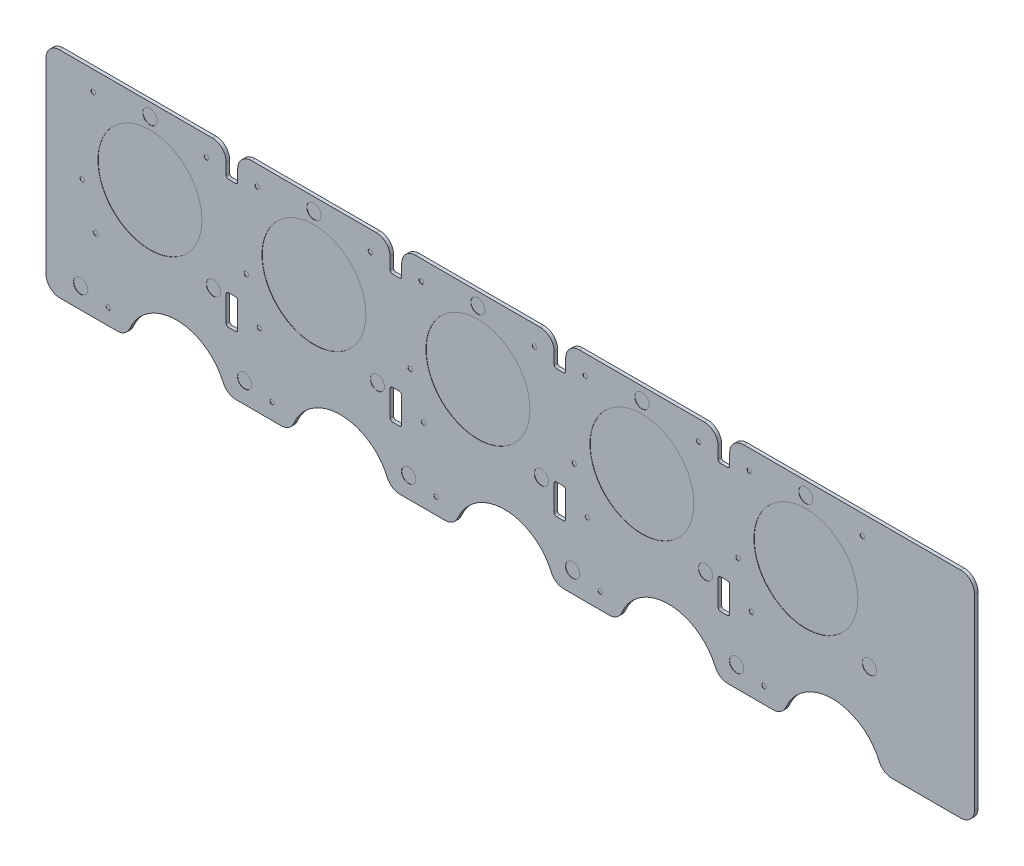
from build123d import *

# Parameters (mm, degrees)
ESQUISSE1_W                                = 402
ESQUISSE1_H                                = 93
PCB_RECTANGULAIRE_DEPTH                    = 1.5
ESQUISSE1_3_R                              = 22.5
POSITION_TROU_DEPTH                        = 0.1
PASSAGE_APPUI_FLANC_ET_PASSAGE_JETON_DEPTH = 224.220182779
R_P_TITION_LIN_AIRE1_COUNT                 = 4
R_P_TITION_LIN_AIRE1_PITCH                 = 71
ESQUISSE2_R                                = 1
ESQUISSE2_R_2                              = 3.1
POSITION_CAPTEUR_LED_DEPTH                 = 0.1
ESQUISSE4_R                                = 22
ECHAPPEMENT_DEPTH                          = 224.220182779
R_P_TITION_LIN_AIRE3_COUNT                 = 5
R_P_TITION_LIN_AIRE3_PITCH                 = 71
CONG_1_R                                   = 6


with BuildPart() as part:
    # Esquisse1 → PCB_rectangulaire (new body)
    with BuildSketch(Plane.XY):
        with Locations((14, -13.5)):
            Rectangle(ESQUISSE1_W, ESQUISSE1_H)
    extrude(amount=-PCB_RECTANGULAIRE_DEPTH)

    # Esquisse1<3> → position_trou (cut)
    with BuildSketch(Plane.XY):
        with Locations((-142, 0)):
            Circle(ESQUISSE1_3_R)
        with Locations((-71, 0)):
            Circle(ESQUISSE1_3_R)
        Circle(ESQUISSE1_3_R)
        with Locations((71, 0)):
            Circle(ESQUISSE1_3_R)
        with Locations((142, 0)):
            Circle(ESQUISSE1_3_R)
    extrude(amount=-POSITION_TROU_DEPTH, mode=Mode.SUBTRACT)

    # Esquisse3 → passage_appui_flanc et passage jeton (cut, through all)
    with BuildSketch(Plane.XY):
        with BuildLine():
            Line((-109, 33), (-104, 33))
            Line((-104, 33), (-104, 22))
            ThreePointArc((-104, 22), (-104.292893219, 21.292893219), (-105, 21))
            Line((-105, 21), (-108, 21))
            ThreePointArc((-108, 21), (-108.707106781, 21.292893219), (-109, 22))
            Line((-109, 22), (-109, 33))
        make_face()
        with BuildLine():
            Line((-108, -21.5), (-105, -21.5))
            ThreePointArc((-105, -21.5), (-104.292893219, -21.792893219), (-104, -22.5))
            Line((-104, -22.5), (-104, -33.5))
            ThreePointArc((-104, -33.5), (-104.292893219, -34.207106781), (-105, -34.5))
            Line((-105, -34.5), (-108, -34.5))
            ThreePointArc((-108, -34.5), (-108.707106781, -34.207106781), (-109, -33.5))
            Line((-109, -33.5), (-109, -22.5))
            ThreePointArc((-109, -22.5), (-108.707106781, -21.792893219), (-108, -21.5))
        make_face()
    passage_appui_flanc_et_passage_jeton = extrude(amount=-PASSAGE_APPUI_FLANC_ET_PASSAGE_JETON_DEPTH, mode=Mode.SUBTRACT)

    # Répétition linéaire1: passage_appui_flanc et passage jeton ×4
    with Locations(*[(i * R_P_TITION_LIN_AIRE1_PITCH, 0, 0) for i in range(1, R_P_TITION_LIN_AIRE1_COUNT)]):
        add(passage_appui_flanc_et_passage_jeton, mode=Mode.SUBTRACT)

    # Esquisse2 → position_capteur-LED (cut)
    with BuildSketch(Plane.XY):
        with Locations((-171.292893219, -10.707106781)):
            Circle(ESQUISSE2_R)
        with Locations((-165.54936099, -28)):
            Circle(ESQUISSE2_R)
        with Locations((-160.056223834, -53.056223834)):
            Circle(ESQUISSE2_R)
        with Locations((-166.492120637, 24.492120637)):
            Circle(ESQUISSE2_R)
        with Locations((-117.507879363, 24.492120637)):
            Circle(ESQUISSE2_R)
        with Locations((-172, -51)):
            Circle(ESQUISSE2_R_2)
        with Locations((-114.5, -23)):
            Circle(ESQUISSE2_R_2)
        with Locations((-142, 27.5)):
            Circle(ESQUISSE2_R_2)
    position_capteur_led = extrude(amount=-POSITION_CAPTEUR_LED_DEPTH, mode=Mode.SUBTRACT)

    # Esquisse4 → echappement (cut, through all)
    with BuildSketch(Plane.XY):
        with Locations((-130.5, -65)):
            Circle(ESQUISSE4_R)
    echappement = extrude(amount=-ECHAPPEMENT_DEPTH, mode=Mode.SUBTRACT)

    # Répétition linéaire3: position_capteur-LED, echappement ×5
    with Locations(*[(i * R_P_TITION_LIN_AIRE3_PITCH, 0, 0) for i in range(1, R_P_TITION_LIN_AIRE3_COUNT)]):
        add(position_capteur_led, mode=Mode.SUBTRACT)
        add(echappement, mode=Mode.SUBTRACT)

    # Congé1
    cong_1_edges = [part.edges().sort_by_distance(p)[0] for p in [
        (-187, -60, -0.75),
        (-187, 33, -0.75),
        (-109, 33, -0.75),
        (-104, 33, -0.75),
        (-38, 33, -0.75),
        (-33, 33, -0.75),
        (33, 33, -0.75),
        (38, 33, -0.75),
        (104, 33, -0.75),
        (109, 33, -0.75),
        (215, 33, -0.75),
        (215, -60, -0.75),
        (-109.075714714, -60, -0.75),
        (-151.924285286, -60, -0.75),
        (174.924285286, -60, -0.75),
        (132.075714714, -60, -0.75),
        (103.924285286, -60, -0.75),
        (61.075714714, -60, -0.75),
        (32.924285286, -60, -0.75),
        (-9.924285286, -60, -0.75),
        (-38.075714714, -60, -0.75),
        (-80.924285286, -60, -0.75),
    ]]
    fillet(cong_1_edges, radius=CONG_1_R)


solid = part.part
